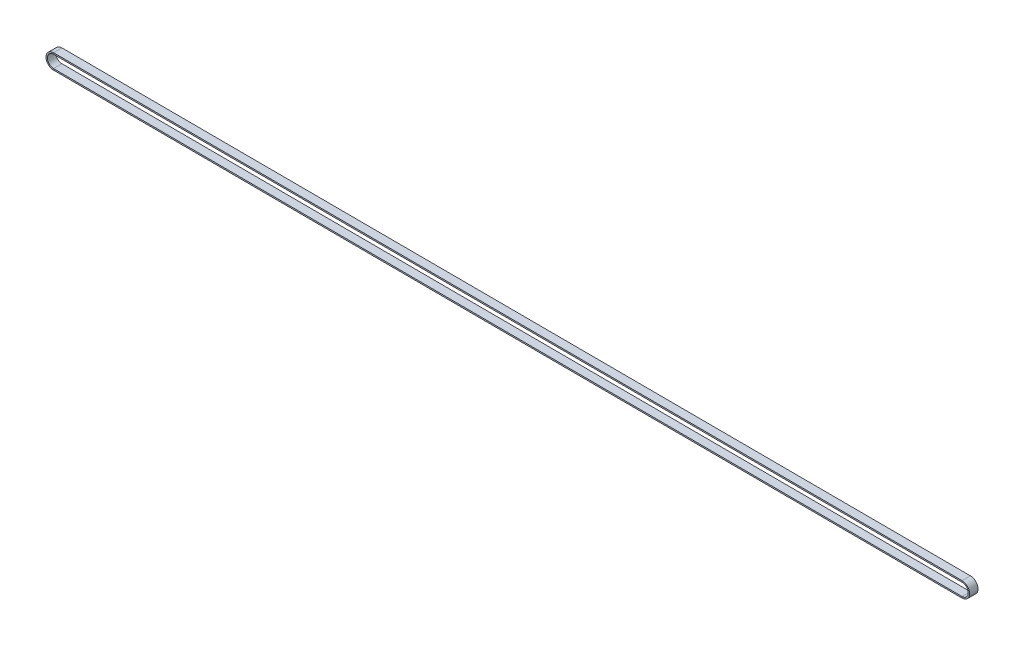
from build123d import *

# Parameters (mm, degrees)
SKETCH3_W = 9
SKETCH3_H = 1.5


with BuildPart() as part:
    # Sweep1: sweep along a path in Sketch2
    with BuildLine(Plane.XY) as sweep1_path:
        Line((-6.431571785, 34.265250178), (-982.757241464, 37.461123294))
        ThreePointArc((-982.757241464, 37.461123294), (-990.870303602, 45.62747394), (-982.703952956, 53.740536078))
        Line((-982.703952956, 53.740536078), (-6.378283278, 50.544662962))
        ThreePointArc((-6.378283278, 50.544662962), (1.734778861, 42.378312316), (-6.431571785, 34.265250178))
    # Sketch3 → Sweep1 (sweep)
    with BuildSketch(Plane(origin=(-6.378283278, 50.544662962, 0), x_dir=(0, 0, -1), z_dir=(0.9999946425743201, -0.003273350371981196, 0))):
        with Locations((4.5, -0.75)):
            Rectangle(SKETCH3_W, SKETCH3_H)
    sweep(path=sweep1_path.line)


solid = part.part
